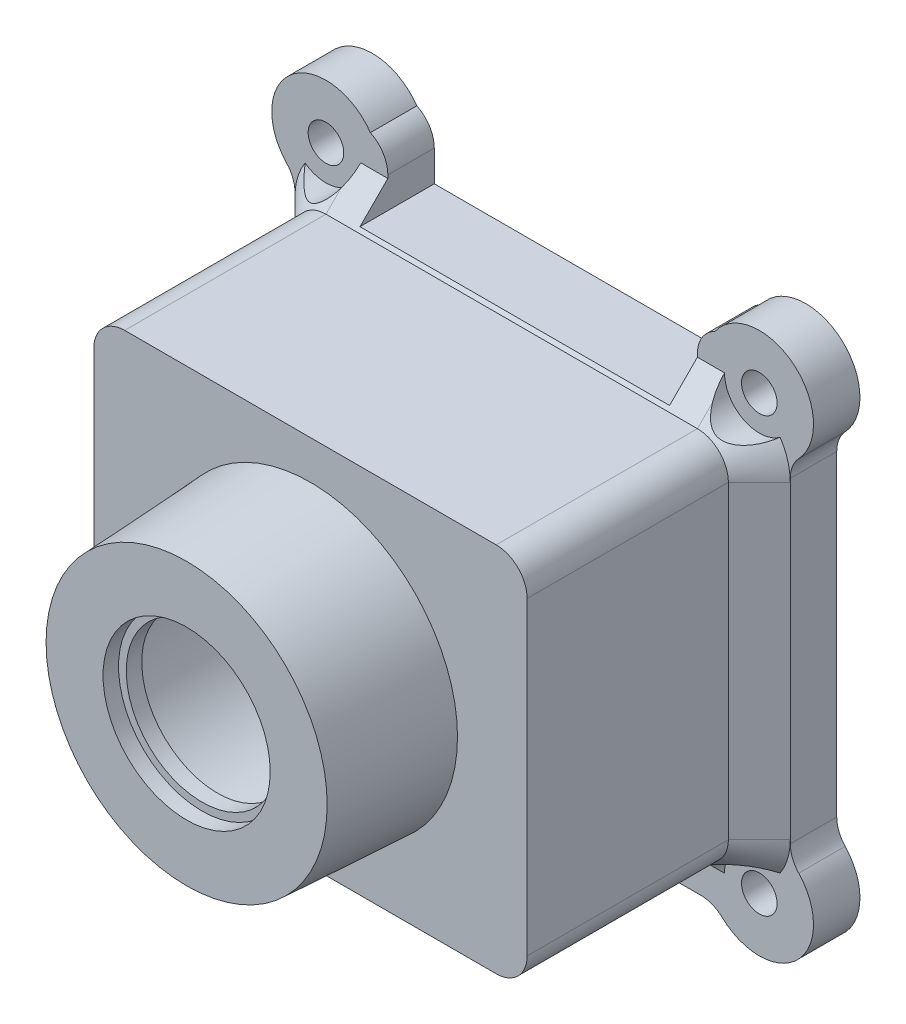
from build123d import *

# Parameters (mm, degrees)
SKETCH_1_W          = 28
SKETCH_1_H          = 24
SKETCH_1_W_2        = 24
SKETCH_1_H_2        = 20
EXTRUDE_1_DEPTH     = 16
SKETCH_2_W          = 32
SKETCH_2_H          = 32
SKETCH_2_R          = 1.15
SKETCH_2_W_2        = 28
SKETCH_2_H_2        = 24
EXTRUDE_2_DEPTH     = 3
SKETCH_3_W          = 28
SKETCH_3_H          = 24
SKETCH_3_R          = 7.25
EXTRUDE_3_DEPTH     = 2
SKETCH_4_R          = 9.5
EXTRUDE_4_DEPTH     = 8
EXTRUDE_4_TAPER     = 3
SKETCH_6_R          = 7.25
CUT_EXTRUDE_2_DEPTH = 29.91366459
EXTRUDE_START       = -2
SKETCH_5_R          = 7.25
SKETCH_5_R_2        = 4.9
EXTRUDE_5_DEPTH     = 2
SKETCH_9_R          = 5.4
CUT_EXTRUDE_5_DEPTH = 1
FILLET_1_R          = 2
CUT_EXTRUDE_3_REACH = 36.467
SKETCH_7_W          = 20
SKETCH_7_H          = 5
CHAMFER_1_SIZE      = 2
SKETCH_8_R          = 2.25
CUT_EXTRUDE_4_DEPTH = 10
EXTRUDE_6_DEPTH     = 3
FILLET_2_R          = 2


with BuildPart() as part:
    # 草图1 → 凸台-拉伸1 (new body)
    with BuildSketch(Plane.XY):
        Rectangle(SKETCH_1_W, SKETCH_1_H)
        Rectangle(SKETCH_1_W_2, SKETCH_1_H_2, mode=Mode.SUBTRACT)
    extrude(amount=EXTRUDE_1_DEPTH)

    # 草图2 → 凸台-拉伸2 (add)
    with BuildSketch(Plane(origin=(0, 0, 0), x_dir=(-1, 0, 0), z_dir=(0, 0, -1))):
        Rectangle(SKETCH_2_W, SKETCH_2_H)
        with Locations((14, 14)):
            Circle(SKETCH_2_R, mode=Mode.SUBTRACT)
        with Locations((14, -14)):
            Circle(SKETCH_2_R, mode=Mode.SUBTRACT)
        with Locations((-14, -14)):
            Circle(SKETCH_2_R, mode=Mode.SUBTRACT)
        with Locations((-14, 14)):
            Circle(SKETCH_2_R, mode=Mode.SUBTRACT)
        Rectangle(SKETCH_2_W_2, SKETCH_2_H_2, mode=Mode.SUBTRACT)
    extrude(amount=-EXTRUDE_2_DEPTH)

    # 草图3 → 凸台-拉伸3 (add)
    with BuildSketch(Plane.XY.offset(16)):
        Rectangle(SKETCH_3_W, SKETCH_3_H)
        Circle(SKETCH_3_R, mode=Mode.SUBTRACT)
    extrude(amount=EXTRUDE_3_DEPTH)

    # 草图4 → 凸台-拉伸4 (add)
    with BuildSketch(Plane.XY.offset(18)):
        Circle(SKETCH_4_R)
    extrude(amount=EXTRUDE_4_DEPTH, taper=EXTRUDE_4_TAPER)

    # 草图6 → 切除-拉伸2 (cut, through all)
    with BuildSketch(Plane(origin=(0, 0, 18), x_dir=(-1, 0, 0), z_dir=(0, 0, -1))):
        Circle(SKETCH_6_R)
    extrude(amount=-CUT_EXTRUDE_2_DEPTH, mode=Mode.SUBTRACT)

    # 草图5 → 凸台-拉伸5 (add)
    with BuildSketch(Plane.XY.offset(26).offset(EXTRUDE_START)):
        Circle(SKETCH_5_R)
        Circle(SKETCH_5_R_2, mode=Mode.SUBTRACT)
    extrude(amount=EXTRUDE_5_DEPTH)

    # 草图9 → 切除-拉伸5 (cut)
    with BuildSketch(Plane.XY.offset(26)):
        Circle(SKETCH_9_R)
    extrude(amount=-CUT_EXTRUDE_5_DEPTH, mode=Mode.SUBTRACT)

    # 圆角1
    fillet_1_edges = [part.edges().sort_by_distance(p)[0] for p in [
        (12, -10, 8),
        (12, 10, 8),
        (-12, 10, 8),
        (-12, -10, 8),
        (14, -12, 10.5),
        (-14, -12, 10.5),
        (-14, 12, 10.5),
        (14, 12, 10.5),
    ]]
    fillet(fillet_1_edges, radius=FILLET_1_R)

    # 草图7 → 切除-拉伸3 (cut, up to next)
    with BuildSketch(Plane(origin=(0, 0, 0), x_dir=(-1, 0, 0), z_dir=(0, 0, -1)), mode=Mode.PRIVATE) as cut_extrude_3_sk1:
        with Locations((0, 14.7)):
            Rectangle(SKETCH_7_W, SKETCH_7_H)
    cut_extrude_3_tool1 = extrude(cut_extrude_3_sk1.sketch, amount=-CUT_EXTRUDE_3_REACH, mode=Mode.PRIVATE) & part.part
    add(cut_extrude_3_tool1.solids().sort_by_distance((0, 14.7, 0))[0], mode=Mode.SUBTRACT)

    # 倒角1
    # the kernel refuses this chamfer: 2 mm, written as the material it adds along each edge
    with BuildSketch(Plane(origin=(-12, 12, 3), x_dir=(0, 1, 0), z_dir=(1, 0, 0))) as chamfer_1_piece_1_section:
        Polygon((CHAMFER_1_SIZE, 0), (0, CHAMFER_1_SIZE), (0, 0), align=None)
    chamfer_1_piece_1 = extrude(amount=24, mode=Mode.PRIVATE)
    chamfer_1_piece_1 = split(chamfer_1_piece_1, bisect_by=Plane(origin=(-12, 12.2, 3), z_dir=(0, 1, 0)), keep=Keep.TOP, mode=Mode.PRIVATE)
    chamfer_1_piece_1 = split(chamfer_1_piece_1, bisect_by=Plane(origin=(-10, 12, 3), z_dir=(-1, 0, 0)), keep=Keep.TOP, mode=Mode.PRIVATE)
    add(chamfer_1_piece_1)
    with BuildSketch(Plane(origin=(-12, 12, 3), x_dir=(0, 1, 0), z_dir=(1, 0, 0))) as chamfer_1_piece_2_section:
        Polygon((CHAMFER_1_SIZE, 0), (0, CHAMFER_1_SIZE), (0, 0), align=None)
    chamfer_1_piece_2 = extrude(amount=24, mode=Mode.PRIVATE)
    chamfer_1_piece_2 = split(chamfer_1_piece_2, bisect_by=Plane(origin=(-12, 12.2, 3), z_dir=(0, -1, 0)), keep=Keep.TOP, mode=Mode.PRIVATE)
    chamfer_1_piece_2 = split(chamfer_1_piece_2, bisect_by=Plane(origin=(-10, 12, 3), z_dir=(-1, 0, 0)), keep=Keep.TOP, mode=Mode.PRIVATE)
    add(chamfer_1_piece_2)
    with BuildSketch(Plane(origin=(-12, 12, 3), x_dir=(0, 1, 0), z_dir=(1, 0, 0))) as chamfer_1_piece_3_section:
        Polygon((CHAMFER_1_SIZE, 0), (0, CHAMFER_1_SIZE), (0, 0), align=None)
    chamfer_1_piece_3 = extrude(amount=24, mode=Mode.PRIVATE)
    chamfer_1_piece_3 = split(chamfer_1_piece_3, bisect_by=Plane(origin=(10, 12, 3), z_dir=(-1, 0, 0)), keep=Keep.TOP, mode=Mode.PRIVATE)
    chamfer_1_piece_3 = split(chamfer_1_piece_3, bisect_by=Plane(origin=(-12, 12.2, 3), z_dir=(0, -1, 0)), keep=Keep.TOP, mode=Mode.PRIVATE)
    chamfer_1_piece_3 = split(chamfer_1_piece_3, bisect_by=Plane(origin=(-10, 12, 3), z_dir=(1, 0, 0)), keep=Keep.TOP, mode=Mode.PRIVATE)
    add(chamfer_1_piece_3)
    with BuildSketch(Plane(origin=(-12, 12, 3), x_dir=(0, 1, 0), z_dir=(1, 0, 0))) as chamfer_1_piece_4_section:
        Polygon((CHAMFER_1_SIZE, 0), (0, CHAMFER_1_SIZE), (0, 0), align=None)
    chamfer_1_piece_4 = extrude(amount=24, mode=Mode.PRIVATE)
    chamfer_1_piece_4 = split(chamfer_1_piece_4, bisect_by=Plane(origin=(10, 12, 3), z_dir=(1, 0, 0)), keep=Keep.TOP, mode=Mode.PRIVATE)
    chamfer_1_piece_4 = split(chamfer_1_piece_4, bisect_by=Plane(origin=(-12, 12.2, 3), z_dir=(0, 1, 0)), keep=Keep.TOP, mode=Mode.PRIVATE)
    add(chamfer_1_piece_4)
    with BuildSketch(Plane(origin=(-12, 12, 3), x_dir=(0, 1, 0), z_dir=(1, 0, 0))) as chamfer_1_piece_5_section:
        Polygon((CHAMFER_1_SIZE, 0), (0, CHAMFER_1_SIZE), (0, 0), align=None)
    chamfer_1_piece_5 = extrude(amount=24, mode=Mode.PRIVATE)
    chamfer_1_piece_5 = split(chamfer_1_piece_5, bisect_by=Plane(origin=(10, 12, 3), z_dir=(1, 0, 0)), keep=Keep.TOP, mode=Mode.PRIVATE)
    chamfer_1_piece_5 = split(chamfer_1_piece_5, bisect_by=Plane(origin=(-12, 12.2, 3), z_dir=(0, -1, 0)), keep=Keep.TOP, mode=Mode.PRIVATE)
    add(chamfer_1_piece_5)
    with BuildSketch(Plane(origin=(12, 10, 3), x_dir=(1, 0, 0), z_dir=(0, -1, 0))) as chamfer_1_piece_6_section:
        Polygon((2 + CHAMFER_1_SIZE, 0), (2, CHAMFER_1_SIZE), (2, 0), align=None)
    chamfer_1_piece_6 = revolve(axis=Axis((12, 10, 3), (0, 0, 1)), revolution_arc=90, mode=Mode.PRIVATE)
    chamfer_1_piece_6 = split(chamfer_1_piece_6, bisect_by=Plane(origin=(16, 10, 3), z_dir=(-1, 0, 0)), keep=Keep.TOP, mode=Mode.PRIVATE)
    chamfer_1_piece_6 = chamfer_1_piece_6 - Plane(origin=(14, 14, 3), x_dir=(-1, 0, 0), z_dir=(0, 0, -1)) * Cylinder(1.15, 16, mode=Mode.PRIVATE)
    add(chamfer_1_piece_6)
    with BuildSketch(Plane(origin=(-12, 10, 3), x_dir=(-1, 0, 0), z_dir=(0, -1, 0))) as chamfer_1_piece_7_section:
        Polygon((2 + CHAMFER_1_SIZE, 0), (2, -CHAMFER_1_SIZE), (2, 0), align=None)
    chamfer_1_piece_7 = revolve(axis=Axis((-12, 10, 3), (0, 0, -1)), revolution_arc=90, mode=Mode.PRIVATE)
    chamfer_1_piece_7 = split(chamfer_1_piece_7, bisect_by=Plane(origin=(-16, 10, 3), z_dir=(1, 0, 0)), keep=Keep.TOP, mode=Mode.PRIVATE)
    chamfer_1_piece_7 = chamfer_1_piece_7 - Plane(origin=(-14, 14, 3), x_dir=(-1, 0, 0), z_dir=(0, 0, -1)) * Cylinder(1.15, 17, mode=Mode.PRIVATE)
    add(chamfer_1_piece_7)
    with BuildSketch(Plane(origin=(14, 10, 3), x_dir=(1, 0, 0), z_dir=(0, -1, 0))) as chamfer_1_piece_8_section:
        Polygon((CHAMFER_1_SIZE, 0), (0, CHAMFER_1_SIZE), (0, 0), align=None)
    chamfer_1_piece_8 = extrude(amount=20, mode=Mode.PRIVATE)
    chamfer_1_piece_8 = split(chamfer_1_piece_8, bisect_by=Plane(origin=(16, 10, 3), z_dir=(-1, 0, 0)), keep=Keep.TOP, mode=Mode.PRIVATE)
    add(chamfer_1_piece_8)
    with BuildSketch(Plane(origin=(-14, -10, 3), x_dir=(-1, 0, 0), z_dir=(0, 1, 0))) as chamfer_1_piece_9_section:
        Polygon((CHAMFER_1_SIZE, 0), (0, CHAMFER_1_SIZE), (0, 0), align=None)
    chamfer_1_piece_9 = extrude(amount=20, mode=Mode.PRIVATE)
    chamfer_1_piece_9 = split(chamfer_1_piece_9, bisect_by=Plane(origin=(-16, -10, 3), z_dir=(1, 0, 0)), keep=Keep.TOP, mode=Mode.PRIVATE)
    add(chamfer_1_piece_9)
    with BuildSketch(Plane(origin=(12, -10, 3), x_dir=(0, -1, 0), z_dir=(-1, 0, 0))) as chamfer_1_piece_10_section:
        Polygon((2 + CHAMFER_1_SIZE, 0), (2, CHAMFER_1_SIZE), (2, 0), align=None)
    chamfer_1_piece_10 = revolve(axis=Axis((12, -10, 3), (0, 0, 1)), revolution_arc=90, mode=Mode.PRIVATE)
    chamfer_1_piece_10 = split(chamfer_1_piece_10, bisect_by=Plane(origin=(16, -10, 3), z_dir=(-1, 0, 0)), keep=Keep.TOP, mode=Mode.PRIVATE)
    chamfer_1_piece_10 = chamfer_1_piece_10 - Plane(origin=(14, -14, 3), x_dir=(-1, 0, 0), z_dir=(0, 0, -1)) * Cylinder(1.15, 16, mode=Mode.PRIVATE)
    add(chamfer_1_piece_10)
    with BuildSketch(Plane(origin=(-12, -10, 3), x_dir=(0, -1, 0), z_dir=(1, 0, 0))) as chamfer_1_piece_11_section:
        Polygon((2 + CHAMFER_1_SIZE, 0), (2, -CHAMFER_1_SIZE), (2, 0), align=None)
    chamfer_1_piece_11 = revolve(axis=Axis((-12, -10, 3), (0, 0, -1)), revolution_arc=90, mode=Mode.PRIVATE)
    chamfer_1_piece_11 = split(chamfer_1_piece_11, bisect_by=Plane(origin=(-16, -10, 3), z_dir=(1, 0, 0)), keep=Keep.TOP, mode=Mode.PRIVATE)
    chamfer_1_piece_11 = chamfer_1_piece_11 - Plane(origin=(-14, -14, 3), x_dir=(-1, 0, 0), z_dir=(0, 0, -1)) * Cylinder(1.15, 17, mode=Mode.PRIVATE)
    add(chamfer_1_piece_11)
    with BuildSketch(Plane(origin=(12, -12, 3), x_dir=(0, 0, 1), z_dir=(-1, 0, 0))) as chamfer_1_piece_12:
        Polygon((CHAMFER_1_SIZE, 0), (0, -CHAMFER_1_SIZE), (0, 0), align=None)
    extrude(amount=24)

    # 草图8 → 切除-拉伸4 (cut)
    with BuildSketch(Plane.XY.offset(3)):
        with Locations((-14, -14)):
            Circle(SKETCH_8_R)
        with Locations((14, -14)):
            Circle(SKETCH_8_R)
        with Locations((14, 14)):
            Circle(SKETCH_8_R)
        with Locations((-14, 14)):
            Circle(SKETCH_8_R)
    extrude(amount=CUT_EXTRUDE_4_DEPTH, mode=Mode.SUBTRACT)

    # 草图10 → 凸台-拉伸6 (add)
    with BuildSketch(Plane.XY.offset(3)):
        with BuildLine():
            Line((16, -16), (16, -11.127718677))
            ThreePointArc((16, -11.127718677), (16.474873734, -16.474873734), (11.127718677, -16))
            Line((11.127718677, -16), (16, -16))
        make_face()
        with BuildLine():
            Line((-16, -16), (-11.127718677, -16))
            ThreePointArc((-11.127718677, -16), (-16.474873734, -16.474873734), (-16, -11.127718677))
            Line((-16, -11.127718677), (-16, -16))
        make_face()
        with BuildLine():
            Line((-16, 16), (-11.127718677, 16))
            ThreePointArc((-11.127718677, 16), (-16.474873734, 16.474873734), (-16, 11.127718677))
            Line((-16, 11.127718677), (-16, 16))
        make_face()
        with BuildLine():
            Line((16, 16), (11.127718677, 16))
            ThreePointArc((11.127718677, 16), (16.474873734, 16.474873734), (16, 11.127718677))
            Line((16, 11.127718677), (16, 16))
        make_face()
    extrude(amount=-EXTRUDE_6_DEPTH)

    # 圆角2
    # the kernel refuses this fillet: 2 mm, written as the material it adds along each edge
    with BuildSketch(Plane(origin=(16, -11.127718677, 3), x_dir=(0, 1, 0), z_dir=(0, 0, -1)), Plane(origin=(-11.127718677, -16, 3), x_dir=(1, 0, 0), z_dir=(0, 0, -1)), Plane(origin=(-16, 11.127718677, 3), x_dir=(0, -1, 0), z_dir=(0, 0, -1))) as fillet_2_piece_1:
        with BuildLine():
            CenterArc((0.902635894, 2), FILLET_2_R, 226.658241773, 43.341758227)
            ThreePointArc((-0.470061276, 0.545454545), (-0.220966302, 0.284847622), (0, 0))
            Line((0, 0), (0.902635894, 0))
        make_face()
    extrude(amount=3)
    with BuildSketch(Plane(origin=(11.127718677, -16, 3), x_dir=(-1, 0, 0), z_dir=(0, 0, -1)), Plane(origin=(-16, -11.127718677, 3), x_dir=(0, 1, 0), z_dir=(0, 0, -1)), Plane(origin=(16, 11.127718677, 3), x_dir=(0, -1, 0), z_dir=(0, 0, -1))) as fillet_2_piece_2:
        with BuildLine():
            CenterArc((0.902635894, -2), FILLET_2_R, 90, 43.341758227)
            ThreePointArc((-0.470061276, -0.545454545), (-0.220966302, -0.284847622), (0, 0))
            Line((0, 0), (0.902635894, 0))
        make_face()
    extrude(amount=3)
    # the kernel refuses this fillet: 2 mm, written as the material it takes off along each edge
    with BuildSketch(Plane(origin=(-10, 16, 7.499392524), x_dir=(-1, 0, 0), z_dir=(0, 0, -1))) as fillet_2_2_piece_1:
        with BuildLine():
            CenterArc((2, -1.799757009), FILLET_2_R, 115.857898182, 64.142101818)
            Line((0, -1.799757009), (0, 0))
            Line((0, 0), (1.127718677, 0))
        make_face()
    extrude(amount=11.998785047, mode=Mode.SUBTRACT)
    with BuildSketch(Plane(origin=(10, 16, -4.499392524), x_dir=(0, -1, 0), z_dir=(0, 0, 1))) as fillet_2_2_piece_2:
        with BuildLine():
            CenterArc((1.799757009, 2), FILLET_2_R, 205.857898182, 64.142101818)
            Line((0, 1.127718677), (0, 0))
            Line((0, 0), (1.799757009, 0))
        make_face()
    extrude(amount=11.998785047, mode=Mode.SUBTRACT)


solid = part.part
